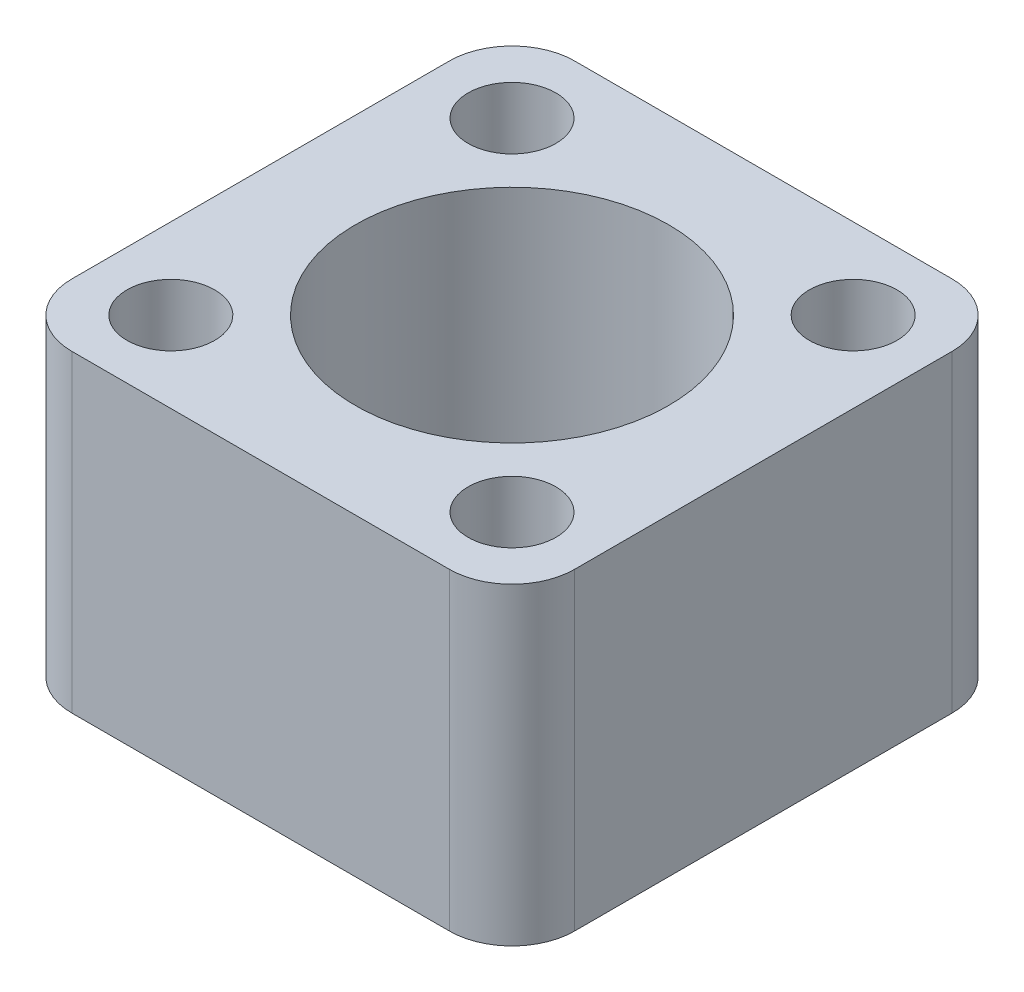
from build123d import *

# Parameters (mm, degrees)
SKETCH3_W           = 20.385181395
SKETCH3_H           = 20.385181395
BOSS_EXTRUDE2_DEPTH = 12.7
SKETCH8_R           = 1.778
SKETCH8_R_2         = 6.35
CUT_EXTRUDE4_DEPTH  = 12.7
FILLET2_R           = 2.54


with BuildPart() as part:
    # Sketch3 → Boss-Extrude2 (new body)
    with BuildSketch(Plane(origin=(0, 0, 0), x_dir=(1, 0, 0), z_dir=(0, 1, 0))):
        with Locations((-10.192590698, 10.192590698)):
            Rectangle(SKETCH3_W, SKETCH3_H)
    extrude(amount=BOSS_EXTRUDE2_DEPTH)

    # Sketch8 → Cut-Extrude4 (cut)
    with BuildSketch(Plane.XZ):
        with Locations((-3.277793484, -17.107387911)):
            Circle(SKETCH8_R)
        with Locations((-17.107387911, -17.107387911)):
            Circle(SKETCH8_R)
        with Locations((-17.107387911, -3.277793484)):
            Circle(SKETCH8_R)
        with Locations((-3.277793484, -3.277793484)):
            Circle(SKETCH8_R)
        with Locations((-10.192590697, -10.192590697)):
            Circle(SKETCH8_R_2)
    extrude(amount=-CUT_EXTRUDE4_DEPTH, mode=Mode.SUBTRACT)

    # Fillet2
    fillet2_edges = [part.edges().sort_by_distance(p)[0] for p in [
        (-20.385181395, 6.35, 0),
        (0, 6.35, 0),
        (0, 6.35, -20.385181395),
        (-20.385181395, 6.35, -20.385181395),
    ]]
    fillet(fillet2_edges, radius=FILLET2_R)


solid = part.part
